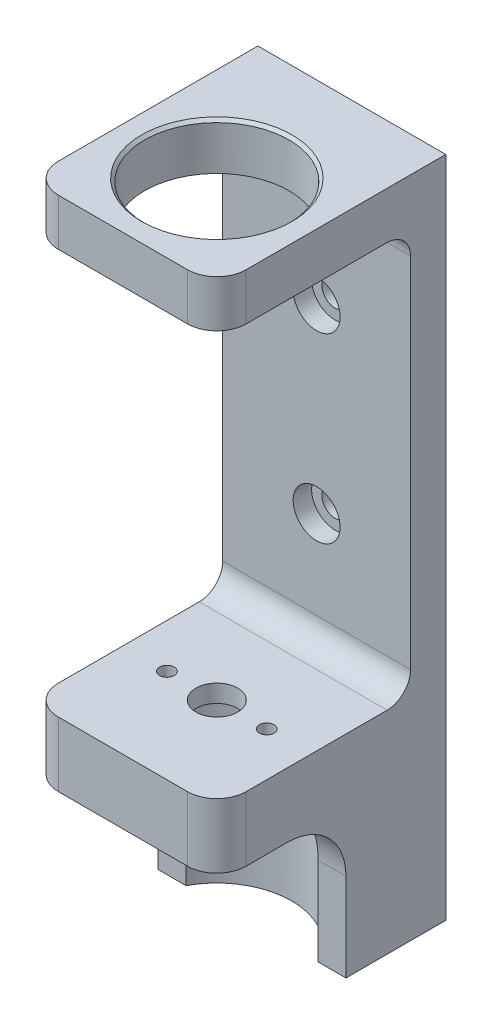
from build123d import *

# Parameters (mm, degrees)
CROQUIS1_W                          = 31
CROQUIS1_H                          = 72
SALIENTE_EXTRUIR1_DEPTH             = 28
CROQUIS2_W                          = 27
CROQUIS2_H                          = 69
CORTAR_EXTRUIR1_DEPTH               = 83.170554337
CROQUIS5_W                          = 13
CROQUIS5_H                          = 10
DI_METRO_DE_TALADRO_2_5_2_5_2_D     = 2.5
DI_METRO_DE_TALADRO_2_5_2_5_2_DEPTH = 11
REDONDEO3_R                         = 5
REDONDEO4_R                         = 3
SALIENTE_EXTRUIR2_START             = 10
CROQUIS14_R                         = 13
SALIENTE_EXTRUIR2_DEPTH             = 10
CROQUIS15_W                         = 28
CROQUIS15_H                         = 82
SALIENTE_EXTRUIR3_DEPTH             = 6
CORTAR_EXTRUIR2_REACH               = 80.511
CROQUIS16_R                         = 3.55
CROQUIS17_R                         = 3.55
SALIENTE_EXTRUIR4_DEPTH             = 6
CORTAR_EXTRUIR3_DEPTH               = 88.475710915
SALIENTE_EXTRUIR5_START             = 10
SALIENTE_EXTRUIR5_DEPTH             = 10
REDONDEO5_R                         = 10
CROQUIS20_R                         = 2.25
CORTAR_EXTRUIR4_DEPTH               = 86.094065614
CROQUIS21_R                         = 4
CROQUIS21_R_2                       = 2.25
CORTAR_EXTRUIR5_DEPTH               = 3.15
SALIENTE_EXTRUIR6_START             = 2
CROQUIS22_R                         = 12.75
CROQUIS22_R_2                       = 1.25
CROQUIS22_R_3                       = 3.55
SALIENTE_EXTRUIR6_DEPTH             = 2
SALIENTE_EXTRUIR7_START             = -8
SALIENTE_EXTRUIR7_DEPTH             = 8
SALIENTE_EXTRUIR8_DEPTH             = 2
SALIENTE_EXTRUIR9_START             = 2
SALIENTE_EXTRUIR9_DEPTH             = 2
SALIENTE_EXTRUIR10_DEPTH            = 11
CROQUIS27_R                         = 12.3
CORTAR_EXTRUIR6_DEPTH               = 8
SALIENTE_EXTRUIR11_START            = 15
SALIENTE_EXTRUIR11_DEPTH            = 15
CHAFL_N1_SIZE                       = 0.5


with BuildPart() as part:
    # Croquis1 → Saliente-Extruir1 (new body)
    with BuildSketch(Plane(origin=(14, 0, 0), x_dir=(0, 0, -1), z_dir=(1, 0, 0))):
        with Locations((-12.5, 36)):
            Rectangle(CROQUIS1_W, CROQUIS1_H)
    extrude(amount=-SALIENTE_EXTRUIR1_DEPTH)

    # Croquis2 → Cortar-Extruir1 (cut, through all)
    with BuildSketch(Plane.ZY.offset(14)):
        with Locations((14.5, 35.5)):
            Rectangle(CROQUIS2_W, CROQUIS2_H)
    extrude(amount=-CORTAR_EXTRUIR1_DEPTH, mode=Mode.SUBTRACT)

    # Croquis5 → Revolución3 (revolve)
    with BuildSketch(Plane(origin=(0, 0, 14), x_dir=(-1, 0, 0), z_dir=(0, 0, -1)), mode=Mode.PRIVATE) as revoluci_n3_sk:
        with Locations((-6.5, -5)):
            Rectangle(CROQUIS5_W, CROQUIS5_H)
    revolve(revoluci_n3_sk.sketch.rotate(Axis((0, -10, 14), (0, 1, 0)), 180), axis=Axis((0, -10, 14), (0, 1, 0)))

    # Croquis6 → Cortar-Revolución1 (revolve, cut)
    with BuildSketch(Plane(origin=(0, 0, 14), x_dir=(-1, 0, 0), z_dir=(0, 0, -1)), mode=Mode.PRIVATE) as cortar_revoluci_n1_sk:
        Polygon((-12.75, -10), (0, -10), (0, 2), (-2.3, 2), (-2.3, 1), (-2.25, 1), (-2.25, 0), (-12.75, 0), align=None)
    revolve(cortar_revoluci_n1_sk.sketch.rotate(Axis((0, -10, 14), (0, 1, 0)), 180), axis=Axis((0, -10, 14), (0, 1, 0)), mode=Mode.SUBTRACT)

    # Diámetro de taladro Ø2.5 (2.5)2
    with Locations(Plane(origin=(0, 1, 0), x_dir=(1, 0, 0), z_dir=(0, 1, 0))):
        with Locations((8.5, -14), (-8.5, -14)):
            Hole(DI_METRO_DE_TALADRO_2_5_2_5_2_D / 2, depth=DI_METRO_DE_TALADRO_2_5_2_5_2_DEPTH)

    # Redondeo3
    redondeo3_edges = [part.edges().sort_by_distance(p)[0] for p in [
        (0, 1, 1),
        (0, 70, 1),
    ]]
    fillet(redondeo3_edges, radius=REDONDEO3_R)

    # Redondeo4
    redondeo4_edges = [part.edges().sort_by_distance(p)[0] for p in [
        (14, 0.5, 28),
        (-14, 0.5, 28),
        (14, 71, 28),
        (-14, 71, 28),
    ]]
    fillet(redondeo4_edges, radius=REDONDEO4_R)

    # Croquis14 → Saliente-Extruir2 (add)
    with BuildSketch(Plane.XZ.offset(SALIENTE_EXTRUIR2_START)):
        with BuildLine():
            Line((11, 28), (-11, 28))
            ThreePointArc((-11, 28), (-13.121320344, 27.121320344), (-14, 25))
            Line((-14, 25), (-14, -3))
            Line((-14, -3), (14, -3))
            Line((14, -3), (14, 25))
            ThreePointArc((14, 25), (13.121320344, 27.121320344), (11, 28))
        make_face()
        with Locations((0, 14)):
            Circle(CROQUIS14_R, mode=Mode.SUBTRACT)
    extrude(amount=-SALIENTE_EXTRUIR2_DEPTH)

    # Croquis15 → Saliente-Extruir3 (add)
    with BuildSketch(Plane(origin=(0, 0, -3), x_dir=(-1, 0, 0), z_dir=(0, 0, -1))):
        with Locations((0, 31)):
            Rectangle(CROQUIS15_W, CROQUIS15_H)
    extrude(amount=SALIENTE_EXTRUIR3_DEPTH)

    # Cortar-Extruir2: up to this face of the body (flat: up to its plane)
    cortar_extruir2_end = Plane(part.part.faces().sort_by_distance((0, 72, 9.433270582))[0])
    # Croquis16 → Cortar-Extruir2 (cut, up to the picked face)
    with BuildSketch(Plane.XZ, mode=Mode.PRIVATE) as cortar_extruir2_sk1:
        with Locations((0, 14)):
            Circle(CROQUIS16_R)
    cortar_extruir2_tool1 = split(extrude(cortar_extruir2_sk1.sketch, amount=-CORTAR_EXTRUIR2_REACH, mode=Mode.PRIVATE), bisect_by=cortar_extruir2_end, keep=Keep.BOTH, mode=Mode.PRIVATE)
    add(cortar_extruir2_tool1.solids().sort_by(Axis((0, 0, 14), (0, 1, 0)))[0], mode=Mode.SUBTRACT)

    # Croquis17 → Saliente-Extruir4 (add)
    with BuildSketch(Plane(origin=(0, 72, 0), x_dir=(1, 0, 0), z_dir=(0, 1, 0))):
        with BuildLine():
            Line((-11, -28), (11, -28))
            ThreePointArc((11, -28), (13.121320344, -27.121320344), (14, -25))
            Line((14, -25), (14, 9))
            Line((14, 9), (-14, 9))
            Line((-14, 9), (-14, -25))
            ThreePointArc((-14, -25), (-13.121320344, -27.121320344), (-11, -28))
        make_face()
        with Locations((0, -14)):
            Circle(CROQUIS17_R, mode=Mode.SUBTRACT)
    extrude(amount=SALIENTE_EXTRUIR4_DEPTH)

    # Croquis18 → Cortar-Extruir3 (cut, through all)
    with BuildSketch(Plane.ZY.offset(14)):
        with BuildLine():
            Line((6, 70), (1, 70))
            ThreePointArc((1, 70), (-1.828427125, 68.828427125), (-3, 66))
            Line((-3, 66), (-3, 5))
            ThreePointArc((-3, 5), (-1.828427125, 2.171572875), (1, 1))
            Line((1, 1), (6, 1))
            ThreePointArc((6, 1), (2.464466094, 2.464466094), (1, 6))
            Line((1, 6), (1, 65))
            ThreePointArc((1, 65), (2.464466094, 68.535533906), (6, 70))
        make_face()
    extrude(amount=-CORTAR_EXTRUIR3_DEPTH, mode=Mode.SUBTRACT)

    # Croquis19 → Saliente-Extruir5 (add)
    with BuildSketch(Plane.XZ.offset(10).offset(SALIENTE_EXTRUIR5_START)):
        with BuildLine():
            Line((-11.25, 8), (-14, 8))
            Line((-14, 8), (-14, -9))
            Line((-14, -9), (14, -9))
            Line((14, -9), (14, 8))
            Line((14, 8), (11.25, 8))
            ThreePointArc((11.25, 8), (0, 1.25), (-11.25, 8))
        make_face()
    extrude(amount=-SALIENTE_EXTRUIR5_DEPTH)

    # Redondeo5
    # the kernel refuses this fillet: 10 mm, written as the material it adds along each edge
    with BuildSketch(Plane(origin=(14, -10, 8), x_dir=(0, -1, 0), z_dir=(-1, 0, 0))) as redondeo5_piece_1_section:
        with BuildLine():
            CenterArc((REDONDEO5_R, REDONDEO5_R), REDONDEO5_R, 180, 90)
            Line((0, REDONDEO5_R), (0, 0))
            Line((0, 0), (REDONDEO5_R, 0))
        make_face()
    redondeo5_piece_1 = extrude(amount=27.75, mode=Mode.PRIVATE)
    redondeo5_piece_1 = redondeo5_piece_1 - Plane(origin=(0, -12.512239399, 14), x_dir=(-1, 0, 0), z_dir=(0, -1, 0)) * Cylinder(12.75, 96, mode=Mode.PRIVATE)
    add(redondeo5_piece_1)
    with BuildSketch(Plane(origin=(13.75, -10, 8), x_dir=(0, -1, 0), z_dir=(-1, 0, 0))) as redondeo5_piece_2_section:
        with BuildLine():
            CenterArc((REDONDEO5_R, REDONDEO5_R), REDONDEO5_R, 180, 90)
            Line((0, REDONDEO5_R), (0, 0))
            Line((0, 0), (REDONDEO5_R, 0))
        make_face()
    redondeo5_piece_2 = extrude(amount=27.75, mode=Mode.PRIVATE)
    redondeo5_piece_2 = redondeo5_piece_2 - Plane(origin=(0, -12.552647231, 14), x_dir=(-1, 0, 0), z_dir=(0, -1, 0)) * Cylinder(12.75, 96, mode=Mode.PRIVATE)
    add(redondeo5_piece_2)

    # Croquis20 → Cortar-Extruir4 (cut, through all)
    with BuildSketch(Plane.XY.offset(-3)):
        with Locations((0, 51)):
            Circle(CROQUIS20_R)
        with Locations((0, 20)):
            Circle(CROQUIS20_R)
    extrude(amount=-CORTAR_EXTRUIR4_DEPTH, mode=Mode.SUBTRACT)

    # Croquis21 → Cortar-Extruir5 (cut)
    # profile 1 of 2: a face of its own
    with BuildSketch(Plane.XY.offset(-3)):
        with Locations((0, 51)):
            Circle(CROQUIS21_R)
        with Locations((0, 51)):
            Circle(CROQUIS21_R_2, mode=Mode.SUBTRACT)
    # profile 2 of 2: a face of its own
    with BuildSketch(Plane.XY.offset(-3)):
        with Locations((0, 20)):
            Circle(CROQUIS21_R)
        with Locations((0, 20)):
            Circle(CROQUIS21_R_2, mode=Mode.SUBTRACT)
    extrude(amount=-CORTAR_EXTRUIR5_DEPTH, mode=Mode.SUBTRACT)

    # Croquis22 → Saliente-Extruir6 (add)
    with BuildSketch(Plane.XZ.offset(SALIENTE_EXTRUIR6_START)):
        with Locations(Location((0, 14, 0), (0, 0, 161.71611006))):
            Circle(CROQUIS22_R)
        with Locations(Location((8.5, 14, 0), (0, 0, 90))):
            Circle(CROQUIS22_R_2, mode=Mode.SUBTRACT)
        with Locations((0, 14)):
            Circle(CROQUIS22_R_3, mode=Mode.SUBTRACT)
        with Locations(Location((-8.5, 14, 0), (0, 0, 90))):
            Circle(CROQUIS22_R_2, mode=Mode.SUBTRACT)
    extrude(amount=-SALIENTE_EXTRUIR6_DEPTH)

    # Croquis23 → Saliente-Extruir7 (add)
    with BuildSketch(Plane(origin=(0, 78, 0), x_dir=(1, 0, 0), z_dir=(0, 1, 0)).offset(SALIENTE_EXTRUIR7_START)):
        with BuildLine():
            Line((-11, -30), (11, -30))
            ThreePointArc((11, -30), (14.535533906, -28.535533906), (16, -25))
            Line((16, -25), (16, 9))
            Line((16, 9), (14, 9))
            Line((14, 9), (14, -25))
            ThreePointArc((14, -25), (13.121320344, -27.121320344), (11, -28))
            Line((11, -28), (-11, -28))
            ThreePointArc((-11, -28), (-13.121320344, -27.121320344), (-14, -25))
            Line((-14, -25), (-14, 9))
            Line((-14, 9), (-16, 9))
            Line((-16, 9), (-16, -25))
            ThreePointArc((-16, -25), (-14.535533906, -28.535533906), (-11, -30))
        make_face()
    extrude(amount=SALIENTE_EXTRUIR7_DEPTH)

    # Croquis24 → Saliente-Extruir8 (add)
    with BuildSketch(Plane.ZY.offset(14)):
        with BuildLine():
            Line((1, 70), (-9, 70))
            Line((-9, 70), (-9, -20))
            Line((-9, -20), (8, -20))
            ThreePointArc((8, -20), (10.928932188, -12.928932188), (18, -10))
            Line((18, -10), (25, -10))
            Line((25, -10), (25, 1))
            Line((25, 1), (1, 1))
            ThreePointArc((1, 1), (-1.828427125, 2.171572875), (-3, 5))
            Line((-3, 5), (-3, 66))
            ThreePointArc((-3, 66), (-1.828427125, 68.828427125), (1, 70))
        make_face()
    extrude(amount=SALIENTE_EXTRUIR8_DEPTH)

    # Croquis25 → Saliente-Extruir9 (add)
    with BuildSketch(Plane(origin=(14, 0, 0), x_dir=(0, 0, -1), z_dir=(1, 0, 0)).offset(SALIENTE_EXTRUIR9_START)):
        with BuildLine():
            Line((9, -20), (9, 70))
            Line((9, 70), (-1, 70))
            ThreePointArc((-1, 70), (1.828427125, 68.828427125), (3, 66))
            Line((3, 66), (3, 5))
            ThreePointArc((3, 5), (1.828427125, 2.171572875), (-1, 1))
            Line((-1, 1), (-25, 1))
            Line((-25, 1), (-25, -10))
            Line((-25, -10), (-18, -10))
            ThreePointArc((-18, -10), (-10.928932188, -12.928932188), (-8, -20))
            Line((-8, -20), (9, -20))
        make_face()
    extrude(amount=-SALIENTE_EXTRUIR9_DEPTH)

    # Croquis26 → Saliente-Extruir10 (add)
    with BuildSketch(Plane.XZ.offset(10)):
        with BuildLine():
            Line((11, 30), (-11, 30))
            ThreePointArc((-11, 30), (-14.535533906, 28.535533906), (-16, 25))
            Line((-16, 25), (-14, 25))
            ThreePointArc((-14, 25), (-13.121320344, 27.121320344), (-11, 28))
            Line((-11, 28), (11, 28))
            ThreePointArc((11, 28), (13.121320344, 27.121320344), (14, 25))
            Line((14, 25), (16, 25))
            ThreePointArc((16, 25), (14.535533906, 28.535533906), (11, 30))
        make_face()
    extrude(amount=-SALIENTE_EXTRUIR10_DEPTH)

    # Croquis27 → Cortar-Extruir6 (cut)
    with BuildSketch(Plane(origin=(0, 78, 0), x_dir=(1, 0, 0), z_dir=(0, 1, 0))):
        with Locations(Location((0, -14, 0), (0, 0, 270))):
            Circle(CROQUIS27_R)
    extrude(amount=-CORTAR_EXTRUIR6_DEPTH, mode=Mode.SUBTRACT)

    # Croquis28 → Saliente-Extruir11 (add)
    with BuildSketch(Plane.XZ.offset(20).offset(SALIENTE_EXTRUIR11_START)):
        with BuildLine():
            Line((16, 8), (11.25, 8))
            ThreePointArc((11.25, 8), (0, 1.25), (-11.25, 8))
            Line((-11.25, 8), (-16, 8))
            Line((-16, 8), (-16, -9))
            Line((-16, -9), (16, -9))
            Line((16, -9), (16, 8))
        make_face()
    extrude(amount=-SALIENTE_EXTRUIR11_DEPTH)

    # Chaflán1
    chafl_n1_edges = [part.edges().sort_by_distance(p)[0] for p in [
        (0, 78, 1.7),
    ]]
    chamfer(chafl_n1_edges, length=CHAFL_N1_SIZE)


solid = part.part
